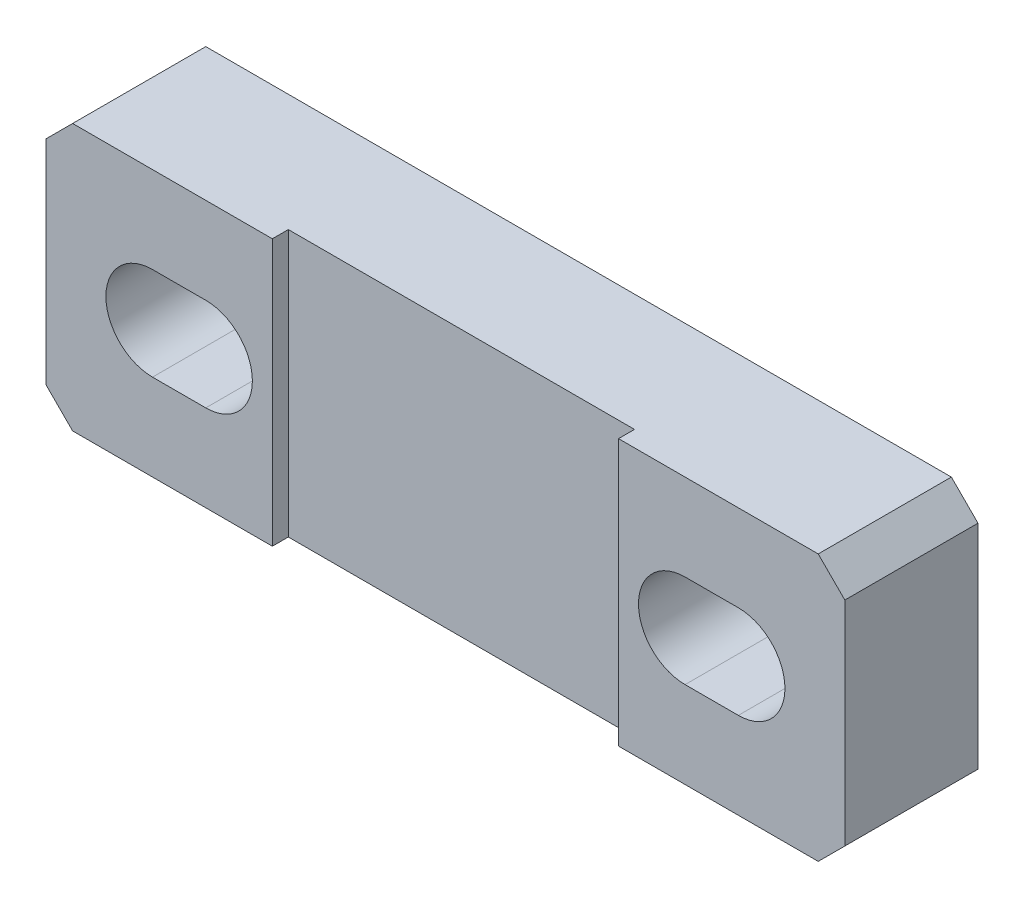
from build123d import *

# Parameters (mm, degrees)
SCHIZZO2_W                   = 30
SCHIZZO2_H                   = 10
ESTRUSIONE_ESTRUSIONE1_DEPTH = 5
SCHIZZO3_W                   = 13
SCHIZZO3_H                   = 10
TAGLIO_ESTRUSIONE1_DEPTH     = 0.6
SMUSSO1_SIZE                 = 1


with BuildPart() as part:
    # Schizzo2 → Estrusione-Estrusione1 (new body)
    with BuildSketch(Plane.XY):
        Rectangle(SCHIZZO2_W, SCHIZZO2_H)
        with BuildLine():
            Line((-9, -1.75), (-11, -1.75))
            ThreePointArc((-11, -1.75), (-12.75, 0), (-11, 1.75))
            Line((-11, 1.75), (-9, 1.75))
            ThreePointArc((-9, 1.75), (-7.25, 0), (-9, -1.75))
        make_face(mode=Mode.SUBTRACT)
        with BuildLine():
            Line((9, -1.75), (11, -1.75))
            ThreePointArc((11, -1.75), (12.75, 0), (11, 1.75))
            Line((11, 1.75), (9, 1.75))
            ThreePointArc((9, 1.75), (7.25, 0), (9, -1.75))
        make_face(mode=Mode.SUBTRACT)
    extrude(amount=-ESTRUSIONE_ESTRUSIONE1_DEPTH)

    # Schizzo3 → Taglio-Estrusione1 (cut)
    with BuildSketch(Plane.XY):
        Rectangle(SCHIZZO3_W, SCHIZZO3_H)
    extrude(amount=-TAGLIO_ESTRUSIONE1_DEPTH, mode=Mode.SUBTRACT)

    # Smusso1
    smusso1_edges = [part.edges().sort_by_distance(p)[0] for p in [
        (15, -5, -2.5),
        (15, 5, -2.5),
        (-15, -5, -2.5),
        (-15, 5, -2.5),
    ]]
    chamfer(smusso1_edges, length=SMUSSO1_SIZE)


solid = part.part
